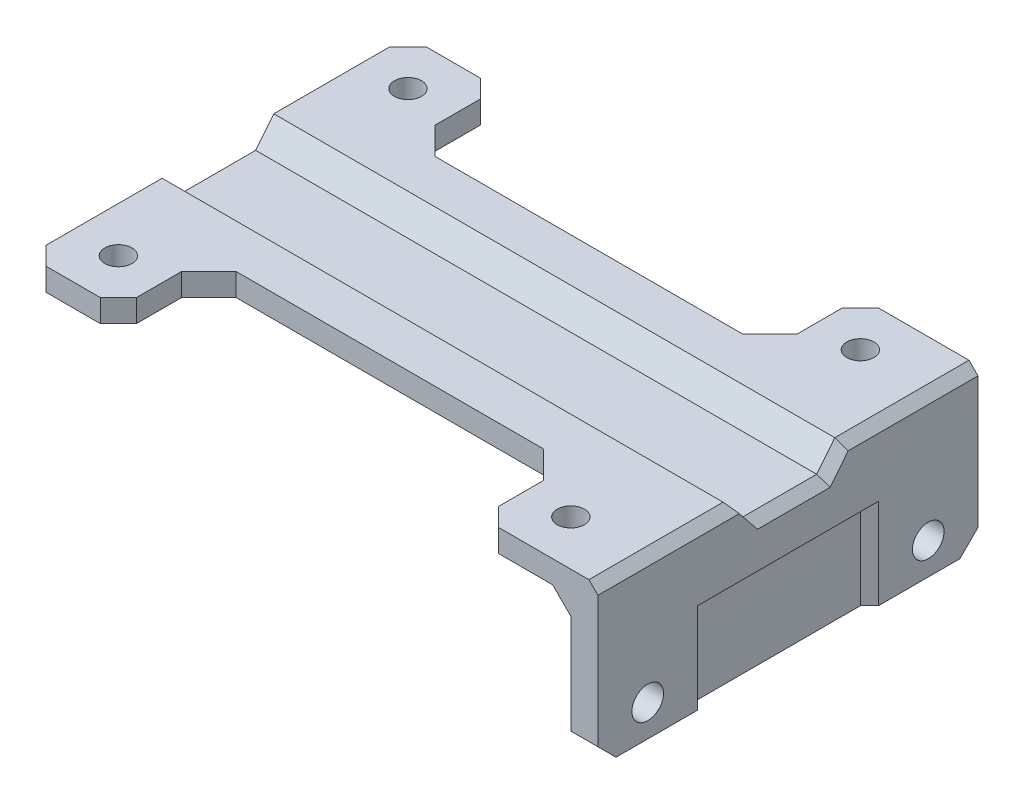
from build123d import *

# Parameters (mm, degrees)
SKETCH_2_W          = 60
SKETCH_2_H          = 42
EXTRUDE_1_DEPTH     = 2.5
CUT_EXTRUDE_START   = 2.5
SKETCH_3_R          = 1.5
CUT_EXTRUDE_1_DEPTH = 2.5
SKETCH_6_W          = 40
SKETCH_6_H          = 10
CUT_EXTRUDE_2_DEPTH = 2.5
SKETCH_7_W          = 60
SKETCH_7_H          = 10
EXTRUDE_3_DEPTH     = 6
EXTRUDE_START       = 2.5
SKETCH_9_W          = 3
SKETCH_9_H          = 42
EXTRUDE_4_DEPTH     = 17.5
EXTRUDE_START_2     = 30
EXTRUDE_5_DEPTH     = 60
CUT_EXTRUDE_START_2 = 30
SKETCH_16_R         = 1.75
CUT_EXTRUDE_3_DEPTH = 3
CUT_EXTRUDE_START_3 = -30
CUT_EXTRUDE_4_DEPTH = 60
CHAMFER_1_SIZE      = 2
CUT_EXTRUDE_6_DEPTH = 63
CHAMFER_2_SIZE      = 2
CUT_EXTRUDE_START_4 = 33
SKETCH_21_W         = 20
SKETCH_21_H         = 10
CUT_EXTRUDE_7_DEPTH = 1
CHAMFER_3_SIZE      = 1
CHAMFER_4_SIZE      = 3


with BuildPart() as part:
    # 草图2 → 凸台-拉伸1 (new body)
    with BuildSketch(Plane(origin=(0, 0, 0), x_dir=(1, 0, 0), z_dir=(0, 1, 0))):
        Rectangle(SKETCH_2_W, SKETCH_2_H)
    extrude(amount=EXTRUDE_1_DEPTH)

    # 草图3 → 切除-拉伸1 (cut)
    with BuildSketch(Plane(origin=(0, 0, 0), x_dir=(1, 0, 0), z_dir=(0, 1, 0)).offset(CUT_EXTRUDE_START)):
        with Locations(Location((-25, 16, 0), (0, 0, 270))):
            Circle(SKETCH_3_R)
        with Locations(Location((25, 16, 0), (0, 0, 270))):
            Circle(SKETCH_3_R)
        with Locations(Location((-25, -16, 0), (0, 0, 270))):
            Circle(SKETCH_3_R)
        with Locations(Location((25, -16, 0), (0, 0, 270))):
            Circle(SKETCH_3_R)
    extrude(amount=-CUT_EXTRUDE_1_DEPTH, mode=Mode.SUBTRACT)

    # 草图6 → 切除-拉伸2 (cut)
    with BuildSketch(Plane(origin=(0, 0, 0), x_dir=(1, 0, 0), z_dir=(0, 1, 0))):
        with Locations((0, 16)):
            Rectangle(SKETCH_6_W, SKETCH_6_H)
        with Locations((0, -16)):
            Rectangle(SKETCH_6_W, SKETCH_6_H)
    extrude(amount=CUT_EXTRUDE_2_DEPTH, mode=Mode.SUBTRACT)

    # 草图7 → 凸台-拉伸3 (add)
    with BuildSketch(Plane(origin=(0, 0, 0), x_dir=(1, 0, 0), z_dir=(0, 1, 0))):
        Rectangle(SKETCH_7_W, SKETCH_7_H)
    extrude(amount=-EXTRUDE_3_DEPTH)

    # 草图9 → 凸台-拉伸4 (add)
    with BuildSketch(Plane(origin=(0, 0, 0), x_dir=(1, 0, 0), z_dir=(0, 1, 0)).offset(EXTRUDE_START)):
        with Locations((31.5, 0)):
            Rectangle(SKETCH_9_W, SKETCH_9_H)
    extrude(amount=-EXTRUDE_4_DEPTH)

    # 草图11 → 凸台-拉伸5 (add)
    with BuildSketch(Plane(origin=(0, 0, 0), x_dir=(0, 0, -1), z_dir=(1, 0, 0)).offset(EXTRUDE_START_2)):
        Polygon((5, -6), (11, 0), (5, 0), align=None)
        Polygon((-5, -6), (-5, 0), (-11, 0), align=None)
    extrude(amount=-EXTRUDE_5_DEPTH)

    # 草图16 → 切除-拉伸3 (cut)
    with BuildSketch(Plane(origin=(0, 0, 0), x_dir=(0, 0, -1), z_dir=(1, 0, 0)).offset(CUT_EXTRUDE_START_2)):
        with Locations(Location((-15.5, -11.5, 0), (0, 0, 180))):
            Circle(SKETCH_16_R)
        with Locations(Location((15.5, -11.5, 0), (0, 0, 180))):
            Circle(SKETCH_16_R)
    extrude(amount=CUT_EXTRUDE_3_DEPTH, mode=Mode.SUBTRACT)

    # 草图18 → 切除-拉伸4 (cut)
    with BuildSketch(Plane(origin=(0, 0, 0), x_dir=(0, 0, -1), z_dir=(1, 0, 0)).offset(CUT_EXTRUDE_START_3)):
        Polygon((6.171572875, -2), (4.171572875, -4), (-4.171572875, -4), (-6.171572875, -2), align=None)
    extrude(amount=CUT_EXTRUDE_4_DEPTH, mode=Mode.SUBTRACT)

    # 倒角1
    chamfer_1_edges = [part.edges().sort_by_distance(p)[0] for p in [
        (30, 0, -16),
        (30, -3, -8),
        (30, -3, 8),
        (30, 0, 16),
    ]]
    chamfer(chamfer_1_edges, length=CHAMFER_1_SIZE)

    # 草图19 → 切除-拉伸6 (cut)
    with BuildSketch(Plane(origin=(0, 0, 0), x_dir=(0, 0, -1), z_dir=(1, 0, 0)).offset(CUT_EXTRUDE_START_3)):
        Polygon((6.171572875, 2.5), (4.171572875, 0), (-4.171572875, 0), (-6.171572875, 2.5), align=None)
    extrude(amount=CUT_EXTRUDE_6_DEPTH, mode=Mode.SUBTRACT)

    # 倒角2
    chamfer_2_edges = [part.edges().sort_by_distance(p)[0] for p in [
        (20, 1.25, 21),
        (-20, 1.25, 21),
        (-20, 1.25, -21),
        (20, 1.25, -21),
        (-30, 1.25, 21),
        (-30, 1.25, -21),
        (31.5, -15, -21),
        (31.5, -15, 21),
    ]]
    chamfer(chamfer_2_edges, length=CHAMFER_2_SIZE)

    # 草图21 → 切除-拉伸7 (cut)
    with BuildSketch(Plane(origin=(0, 0, 0), x_dir=(0, 0, -1), z_dir=(1, 0, 0)).offset(CUT_EXTRUDE_START_4)):
        with Locations((0, -10)):
            Rectangle(SKETCH_21_W, SKETCH_21_H)
    extrude(amount=-CUT_EXTRUDE_7_DEPTH, mode=Mode.SUBTRACT)

    # 倒角3
    chamfer_3_edges = [part.edges().sort_by_distance(p)[0] for p in [
        (33, 2.5, 13.585786438),
        (33, 0, 0),
        (33, 1.25, -5.171572875),
        (33, 2.5, -13.585786438),
        (32, -10, -10),
        (32, -10, 10),
        (32, -5, 0),
    ]]
    chamfer(chamfer_3_edges, length=CHAMFER_3_SIZE - 0.0001)  # a hair under: the kernel refuses the full size

    # 倒角4
    chamfer_4_edges = [part.edges().sort_by_distance(p)[0] for p in [
        (-20, 1.25, 11),
        (20, 1.25, 11),
        (20, 1.25, -11),
        (-20, 1.25, -11),
    ]]
    chamfer(chamfer_4_edges, length=CHAMFER_4_SIZE)


solid = part.part
